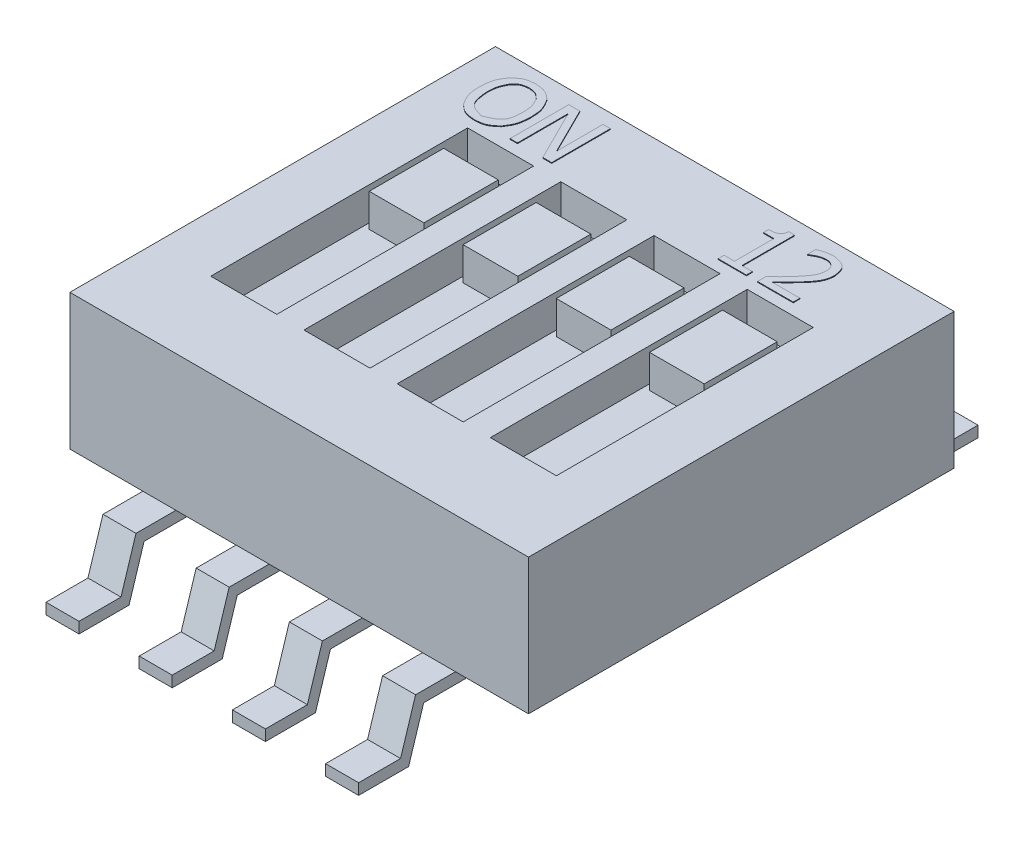
from build123d import *

# Parameters (mm, degrees)
SKETCH1_W           = 6.25
SKETCH1_H           = 5.8
BOSS_EXTRUDE1_DEPTH = 2.65
CHAMFER1_SIZE       = 0.8
BOSS_EXTRUDE2_DEPTH = 0.225
LPATTERN1_COUNT     = 4
LPATTERN1_PITCH     = 1.27
SKETCH3_W           = 0.9
SKETCH3_H           = 3.5
CUT_EXTRUDE1_DEPTH  = 0.45
SKETCH4_W           = 0.745101738
SKETCH4_H           = 1.014044338
SKETCH4_H_2         = 0.995302013
BOSS_EXTRUDE3_DEPTH = 0.45
WRAP1_DEPTH         = 0.01


# Read off the part's stored shape, not the designer's step: Wrap1
with BuildPart() as part:
    # Sketch1 → Boss-Extrude1 (new body)
    with BuildSketch(Plane(origin=(0, 0, 0), x_dir=(1, 0, 0), z_dir=(0, 1, 0))):
        Rectangle(SKETCH1_W, SKETCH1_H)
    extrude(amount=BOSS_EXTRUDE1_DEPTH)

    # Chamfer1
    chamfer1_edges = [part.edges().sort_by_distance(p)[0] for p in [
        (0, 0, 2.9),
        (-3.125, 0, 0),
        (0, 0, -2.9),
        (3.125, 0, 0),
    ]]
    chamfer(chamfer1_edges, length=CHAMFER1_SIZE)

    # Sketch2 → Boss-Extrude2 (add, symmetric)
    with BuildSketch(Plane(origin=(1.905, 0, 0), x_dir=(0, 0, -1), z_dir=(1, 0, 0))):
        Polygon((-4.22, 0.15), (-4.22, 0), (-3.538412914, 0), (-3.333776543, 0.65), (-2.75, 0.65), (-2.9, 0.8), (-3.443810786, 0.8), (-3.648447157, 0.15), align=None)
        Polygon((3.443810786, 0.8), (3.648447157, 0.15), (4.22, 0.15), (4.22, 0), (3.538412914, 0), (3.333776543, 0.65), (2.75, 0.65), (2.9, 0.8), align=None)
    boss_extrude2 = extrude(amount=BOSS_EXTRUDE2_DEPTH, both=True)

    # LPattern1: Boss-Extrude2 ×4
    with Locations(*[(-i * LPATTERN1_PITCH, 0, 0) for i in range(1, LPATTERN1_COUNT)]):
        add(boss_extrude2)

    # Sketch3 → Cut-Extrude1 (cut)
    with BuildSketch(Plane(origin=(0, 2.65, 0), x_dir=(1, 0, 0), z_dir=(0, 1, 0))):
        with Locations((-1.905, 0)):
            Rectangle(SKETCH3_W, SKETCH3_H)
        with Locations((-0.635, 0)):
            Rectangle(SKETCH3_W, SKETCH3_H)
        with Locations((0.635, 0)):
            Rectangle(SKETCH3_W, SKETCH3_H)
        with Locations((1.905, 0)):
            Rectangle(SKETCH3_W, SKETCH3_H)
    extrude(amount=-CUT_EXTRUDE1_DEPTH, mode=Mode.SUBTRACT)

    # Sketch4 → Boss-Extrude3 (add)
    with BuildSketch(Plane(origin=(0, 2.2, 0), x_dir=(1, 0, 0), z_dir=(0, 1, 0))):
        with Locations((-1.905, 0.838979074)):
            Rectangle(SKETCH4_W, SKETCH4_H)
        with Locations((-0.635, 0.838979074)):
            Rectangle(SKETCH4_W, SKETCH4_H_2)
        with Locations((0.635, 0.838979074)):
            Rectangle(SKETCH4_W, SKETCH4_H_2)
        with Locations((1.905, 0.838979074)):
            Rectangle(SKETCH4_W, SKETCH4_H_2)
    extrude(amount=BOSS_EXTRUDE3_DEPTH)

    # Wrap1 outline → Wrap1 (add)
    # profile 1 of 4: a face of its own
    with BuildSketch(Plane(origin=(0, 2.65, 0), x_dir=(1, 0, 0), z_dir=(0, 1, 0))):
        with BuildLine():
            add(Edge.make_bspline(
                [(-2.750316456, 2.303396125), (-2.748613371, 2.254197505), (-2.744758114, 2.14282705), (-2.686891994, 2.046950329), (-2.654588608, 1.99342777)],
                knots=[0, 0, 0, 0, 0.441756473, 1, 1, 1, 1], degree=3))
            add(Edge.make_bspline(
                [(-2.654588608, 1.99342777), (-2.622825353, 1.963879845), (-2.550665592, 1.896752868), (-2.45163941, 1.888230443), (-2.396202532, 1.883459416)],
                knots=[0, 0, 0, 0, 0.440179589, 1, 1, 1, 1], degree=3))
            add(Edge.make_bspline(
                [(-2.396202532, 1.883459416), (-2.352859516, 1.886260486), (-2.254750376, 1.89260085), (-2.179706932, 1.957307476), (-2.137816456, 1.99342777)],
                knots=[0, 0, 0, 0, 0.441783674, 1, 1, 1, 1], degree=3))
            add(Edge.make_bspline(
                [(-2.137816456, 1.99342777), (-2.11101464, 2.034579265), (-2.050020751, 2.128229252), (-2.044532379, 2.240473837), (-2.041455696, 2.303396125)],
                knots=[0, 0, 0, 0, 0.439418049, 1, 1, 1, 1], degree=3))
            add(Edge.make_bspline(
                [(-2.041455696, 2.303396125), (-2.043156095, 2.352787292), (-2.047005902, 2.464611886), (-2.105280713, 2.56077994), (-2.137816456, 2.614472074)],
                knots=[0, 0, 0, 0, 0.441684294, 1, 1, 1, 1], degree=3))
            add(Edge.make_bspline(
                [(-2.137816456, 2.614472074), (-2.169830379, 2.643531839), (-2.24252899, 2.709522017), (-2.341060724, 2.718782984), (-2.396202532, 2.723965745)],
                knots=[0, 0, 0, 0, 0.440365001, 1, 1, 1, 1], degree=3))
            add(Edge.make_bspline(
                [(-2.396202532, 2.723965745), (-2.439378939, 2.721083611), (-2.537125272, 2.714558798), (-2.612099183, 2.650329868), (-2.653955696, 2.614472074)],
                knots=[0, 0, 0, 0, 0.44171895, 1, 1, 1, 1], degree=3))
            add(Edge.make_bspline(
                [(-2.653955696, 2.614472074), (-2.680824251, 2.573140847), (-2.741940036, 2.479127959), (-2.747308275, 2.366505797), (-2.750316456, 2.303396125)],
                knots=[0, 0, 0, 0, 0.439633636, 1, 1, 1, 1], degree=3))
        make_face()
        with BuildLine():
            add(Edge.make_bspline(
                [(-2.152848101, 2.303396125), (-2.155306242, 2.230744295), (-2.160741453, 2.070103326), (-2.312464929, 2.008397354), (-2.39556962, 1.974598656)],
                knots=[0, 0, 0, 0, 0.452262146, 1, 1, 1, 1], degree=3))
            add(Edge.make_bspline(
                [(-2.39556962, 1.974598656), (-2.463602582, 1.994953329), (-2.619863195, 2.041704693), (-2.632045624, 2.208960425), (-2.638924051, 2.303396125)],
                knots=[0, 0, 0, 0, 0.435381384, 1, 1, 1, 1], degree=3))
            add(Edge.make_bspline(
                [(-2.638924051, 2.303396125), (-2.63798138, 2.341705486), (-2.635847104, 2.428440697), (-2.59578508, 2.505783723), (-2.573417722, 2.548965745)],
                knots=[0, 0, 0, 0, 0.44168176, 1, 1, 1, 1], degree=3))
            add(Edge.make_bspline(
                [(-2.573417722, 2.548965745), (-2.552449491, 2.57143575), (-2.504878561, 2.622413781), (-2.434773755, 2.629091935), (-2.39556962, 2.632826504)],
                knots=[0, 0, 0, 0, 0.440778221, 1, 1, 1, 1], degree=3))
            add(Edge.make_bspline(
                [(-2.39556962, 2.632826504), (-2.365079448, 2.630478887), (-2.29606722, 2.625165231), (-2.246193519, 2.576262722), (-2.21835443, 2.548965745)],
                knots=[0, 0, 0, 0, 0.44180825, 1, 1, 1, 1], degree=3))
            add(Edge.make_bspline(
                [(-2.21835443, 2.548965745), (-2.199792744, 2.515587003), (-2.157540084, 2.439605726), (-2.154533747, 2.352330918), (-2.152848101, 2.303396125)],
                knots=[0, 0, 0, 0, 0.4393022, 1, 1, 1, 1], degree=3))
        make_face(mode=Mode.SUBTRACT)
    # profile 2 of 4: a face of its own
    with BuildSketch(Plane(origin=(0, 2.65, 0), x_dir=(1, 0, 0), z_dir=(0, 1, 0))):
        with BuildLine():
            Line((1.148417722, 2.70371258), (1.066613924, 2.70371258))
            add(Edge.make_bspline(
                [(1.066613924, 2.70371258), (1.06436923, 2.684822145), (1.059912367, 2.64731499), (1.001627177, 2.592364417), (0.94397493, 2.592337916), (0.905379747, 2.592320175)],
                knots=[0, 0, 0, 0, 0.251167417, 0.49869551, 1, 1, 1, 1], degree=3))
            Line((0.905379747, 2.592320175), (0.905379747, 2.521434099))
            Line((0.905379747, 2.521434099), (1.047151899, 2.521434099))
            Line((1.047151899, 2.521434099), (1.047151899, 1.984725239))
            Line((1.047151899, 1.984725239), (0.905379747, 1.984725239))
            Line((0.905379747, 1.984725239), (0.905379747, 1.90371258))
            Line((0.905379747, 1.90371258), (1.290189873, 1.90371258))
            Line((1.290189873, 1.90371258), (1.290189873, 1.984725239))
            Line((1.290189873, 1.984725239), (1.148417722, 1.984725239))
            Line((1.148417722, 1.984725239), (1.148417722, 2.70371258))
        make_face()
    # profile 3 of 4: a face of its own
    with BuildSketch(Plane(origin=(0, 2.65, 0), x_dir=(1, 0, 0), z_dir=(0, 1, 0))):
        with BuildLine():
            add(Edge.make_bspline(
                [(1.751265823, 2.203554353), (1.768435097, 2.222488113), (1.807436706, 2.265497915), (1.839188176, 2.314141234), (1.856962025, 2.341370808)],
                knots=[0, 0, 0, 0, 0.440219646, 1, 1, 1, 1], degree=3))
            add(Edge.make_bspline(
                [(1.856962025, 2.341370808), (1.867733935, 2.363698373), (1.892196566, 2.414403494), (1.895779558, 2.470752388), (1.89778481, 2.50228853)],
                knots=[0, 0, 0, 0, 0.440341413, 1, 1, 1, 1], degree=3))
            add(Edge.make_bspline(
                [(1.89778481, 2.50228853), (1.888255635, 2.558685446), (1.866720324, 2.686138778), (1.736413235, 2.710425611), (1.663765823, 2.723965745)],
                knots=[0, 0, 0, 0, 0.44249072, 1, 1, 1, 1], degree=3))
            add(Edge.make_bspline(
                [(1.663765823, 2.723965745), (1.633140887, 2.721676185), (1.563534847, 2.716472347), (1.49866852, 2.690340649), (1.462341772, 2.675706251)],
                knots=[0, 0, 0, 0, 0.439975258, 1, 1, 1, 1], degree=3))
            Line((1.462341772, 2.675706251), (1.462341772, 2.561940428))
            add(Edge.make_bspline(
                [(1.462341772, 2.561940428), (1.474781911, 2.569326914), (1.501285574, 2.58506379), (1.52856357, 2.599418427), (1.543037975, 2.607035365)],
                knots=[0, 0, 0, 0, 0.469374337, 1, 1, 1, 1], degree=3))
            add(Edge.make_bspline(
                [(1.543037975, 2.607035365), (1.558667324, 2.613208964), (1.594151563, 2.627225251), (1.632194453, 2.630816855), (1.653481013, 2.632826504)],
                knots=[0, 0, 0, 0, 0.440458919, 1, 1, 1, 1], degree=3))
            add(Edge.make_bspline(
                [(1.653481013, 2.632826504), (1.668731128, 2.632052504), (1.703287169, 2.630298655), (1.732241426, 2.611008615), (1.748417722, 2.600231568)],
                knots=[0, 0, 0, 0, 0.441315468, 1, 1, 1, 1], degree=3))
            add(Edge.make_bspline(
                [(1.748417722, 2.600231568), (1.75879213, 2.587305505), (1.782385288, 2.557909456), (1.784953494, 2.520030371), (1.786392405, 2.498807517)],
                knots=[0, 0, 0, 0, 0.439721072, 1, 1, 1, 1], degree=3))
            add(Edge.make_bspline(
                [(1.786392405, 2.498807517), (1.784314292, 2.474166187), (1.780157256, 2.42487393), (1.747410357, 2.357446068), (1.697130617, 2.286306361), (1.656189114, 2.238854708), (1.631329114, 2.210041694)],
                knots=[0, 0, 0, 0, 0.219678789, 0.439443119, 0.659625498, 1, 1, 1, 1], degree=3))
            add(Edge.make_bspline(
                [(1.631329114, 2.210041694), (1.604509708, 2.180549514), (1.543553752, 2.113518798), (1.478512823, 2.050433826), (1.442088608, 2.015104985)],
                knots=[0, 0, 0, 0, 0.439980083, 1, 1, 1, 1], degree=3))
            Line((1.442088608, 2.015104985), (1.442088608, 1.90371258))
            Line((1.442088608, 1.90371258), (1.928164557, 1.90371258))
            Line((1.928164557, 1.90371258), (1.928164557, 1.994851821))
            Line((1.928164557, 1.994851821), (1.54193038, 1.994851821))
            add(Edge.make_bspline(
                [(1.54193038, 1.994851821), (1.573457657, 2.024637066), (1.645103323, 2.092323969), (1.713158146, 2.163627528), (1.751265823, 2.203554353)],
                knots=[0, 0, 0, 0, 0.440044438, 1, 1, 1, 1], degree=3))
        make_face()
    # profile 4 of 4: a face of its own
    with BuildSketch(Plane(origin=(0, 2.65, 0), x_dir=(1, 0, 0), z_dir=(0, 1, 0))):
        Polygon((-1.464240506, 2.070326504), (-1.778481013, 2.70371258), (-1.930063291, 2.70371258), (-1.930063291, 1.90371258), (-1.828797468, 1.90371258), (-1.828797468, 2.593585998), (-1.483702532, 1.90371258), (-1.362974684, 1.90371258), (-1.362974684, 2.70371258), (-1.464240506, 2.70371258), align=None)
    extrude(amount=WRAP1_DEPTH)


solid = part.part
